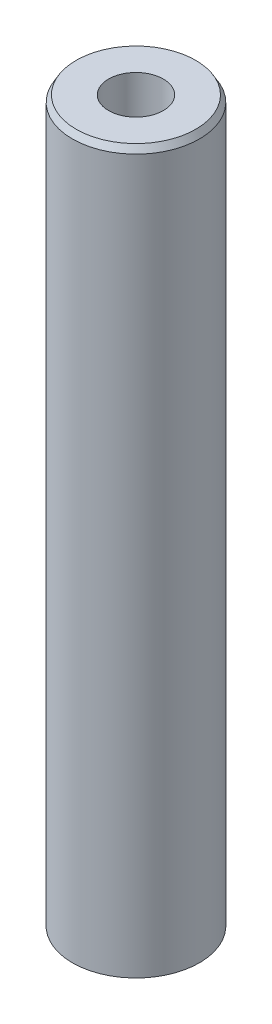
from build123d import *
from OCP.BRepFilletAPI import BRepFilletAPI_MakeChamfer

# Parameters (mm, degrees)
SKETCH1_R           = 47.5
BOSS_EXTRUDE1_DEPTH = 541.152869146
SKETCH2_R           = 20.47097675
CUT_EXTRUDE1_DEPTH  = 546.30626971
CHAMFER1_SIZE       = 4.86260117
CHAMFER1_SIZE2      = 2.807424094


with BuildPart() as part:
    # Sketch1 → Boss-Extrude1 (new body)
    with BuildSketch(Plane(origin=(0, 0, 0), x_dir=(1, 0, 0), z_dir=(0, 1, 0))):
        Circle(SKETCH1_R)
    extrude(amount=BOSS_EXTRUDE1_DEPTH)

    # Sketch2 → Cut-Extrude1 (cut, through all)
    with BuildSketch(Plane(origin=(0, 0, 0), x_dir=(1, 0, 0), z_dir=(0, 1, 0))):
        Circle(SKETCH2_R)
    extrude(amount=CUT_EXTRUDE1_DEPTH, mode=Mode.SUBTRACT)

    # Chamfer1: one chamfer whose edges measure the first distance from different faces: ONE call of the kernel's chamfer builder (chamfer() names one face for all edges)
    chamfer1_edges_1 = [part.edges().sort_by_distance(p)[0] for p in [
        (-47.5, 541.152869146, 0),
    ]]
    chamfer1_side_1 = [part.faces().sort_by_distance(p)[0] for p in [
        (-47.5, 270.576434573, 0),
    ]]
    chamfer1_edges_2 = [part.edges().sort_by_distance(p)[0] for p in [
        (-47.5, 0, 0),
    ]]
    chamfer1_side_2 = [part.faces().sort_by_distance(p)[0] for p in [
        (-46.156497116, 0, 0),
    ]]
    chamfer1 = BRepFilletAPI_MakeChamfer(part.part.solid().wrapped)
    for e in chamfer1_edges_1:
        chamfer1.Add(CHAMFER1_SIZE, CHAMFER1_SIZE2, e.wrapped, chamfer1_side_1[0].wrapped)  # the first distance lies on this face
    for e in chamfer1_edges_2:
        chamfer1.Add(CHAMFER1_SIZE, CHAMFER1_SIZE2, e.wrapped, chamfer1_side_2[0].wrapped)  # the first distance lies on this face
    add(Compound.cast(chamfer1.Shape()), mode=Mode.REPLACE)


solid = part.part
